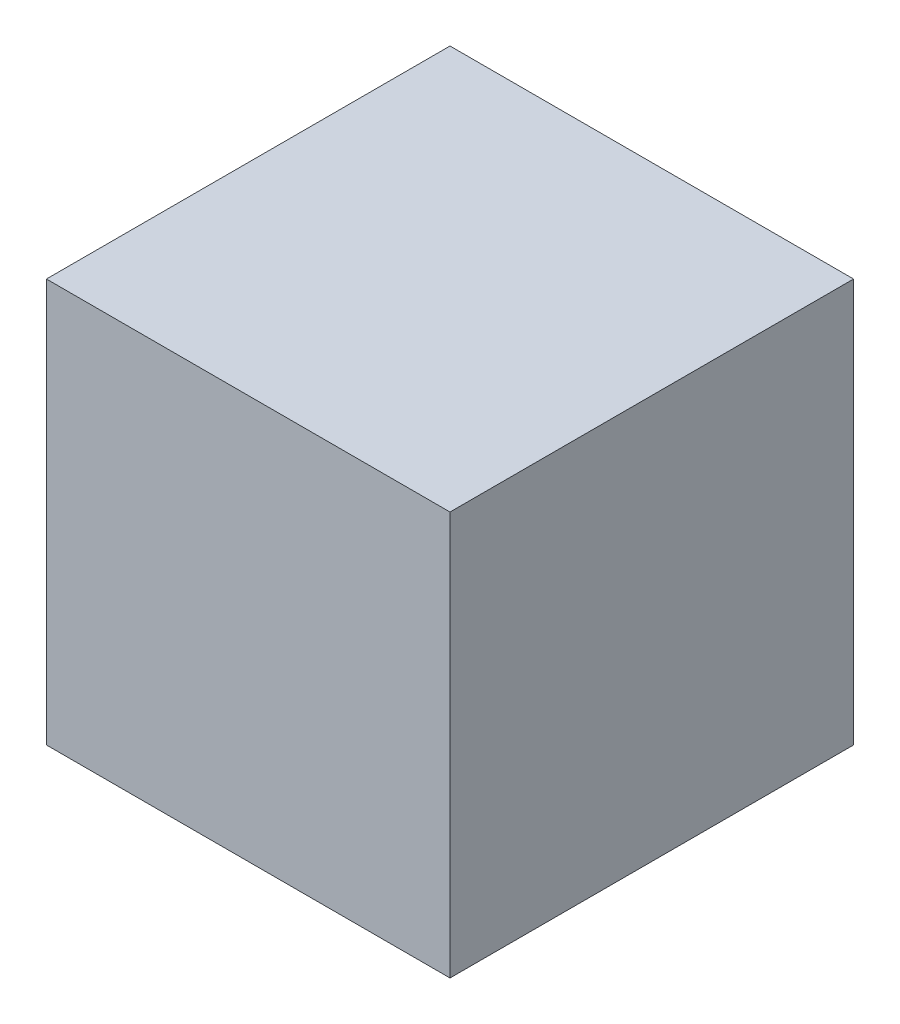
from build123d import *

# Parameters (mm, degrees)
SKETCH1_W           = 254
SKETCH1_H           = 254
BOSS_EXTRUDE1_DEPTH = 254


with BuildPart() as part:
    # Sketch1 → Boss-Extrude1 (new body)
    with BuildSketch(Plane(origin=(0, 0, 0), x_dir=(1, 0, 0), z_dir=(0, 1, 0))):
        with Locations((127, 127)):
            Rectangle(SKETCH1_W, SKETCH1_H)
    extrude(amount=BOSS_EXTRUDE1_DEPTH)


solid = part.part
